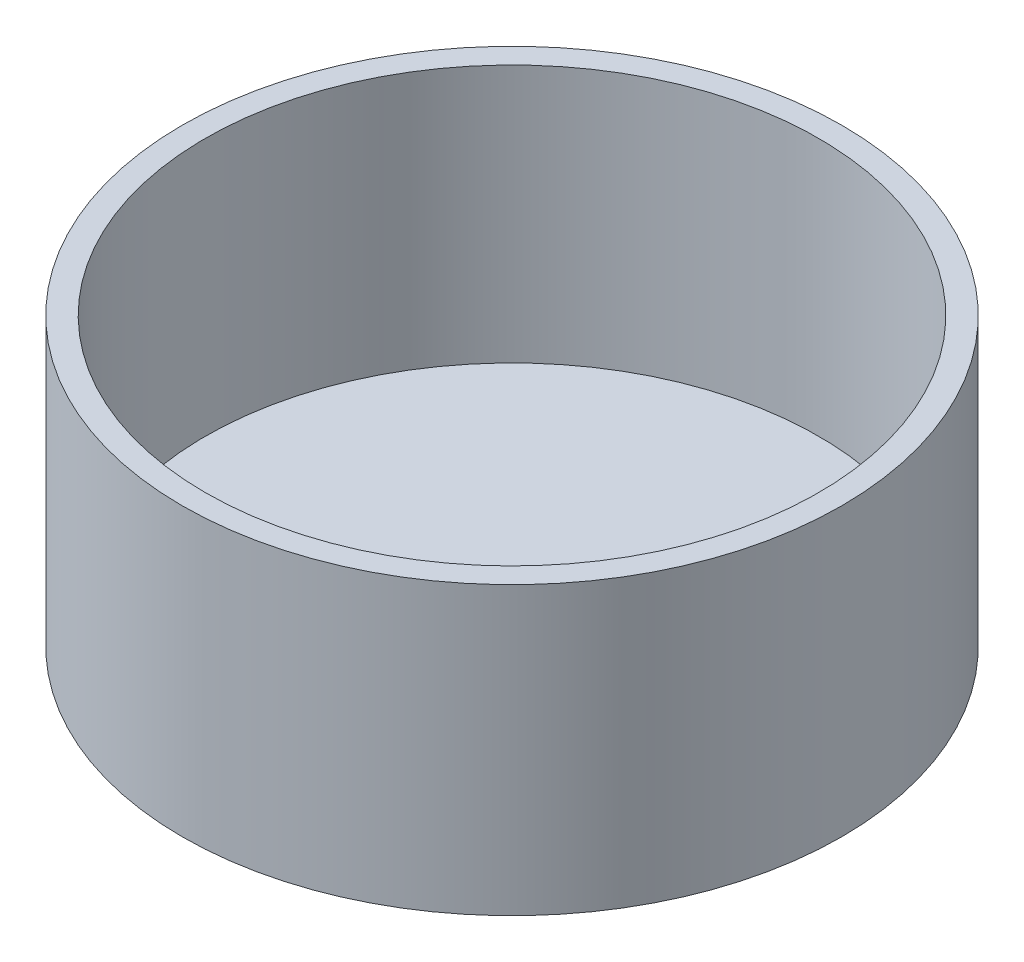
from build123d import *

# Parameters (mm, degrees)
SKETCH_1_R      = 21.4
EXTRUDE_1_DEPTH = 2
SKETCH_2_R      = 23
SKETCH_2_R_2    = 21.4
EXTRUDE_2_DEPTH = 20


with BuildPart() as part:
    # 草图1 → 凸台-拉伸1 (new body)
    with BuildSketch(Plane(origin=(0, 0, 0), x_dir=(1, 0, 0), z_dir=(0, 1, 0))):
        Circle(SKETCH_1_R)
    extrude(amount=EXTRUDE_1_DEPTH)

    # 草图2 → 凸台-拉伸2 (add)
    with BuildSketch(Plane(origin=(0, 0, 0), x_dir=(1, 0, 0), z_dir=(0, 1, 0))):
        Circle(SKETCH_2_R)
        Circle(SKETCH_2_R_2, mode=Mode.SUBTRACT)
    extrude(amount=EXTRUDE_2_DEPTH)


solid = part.part
